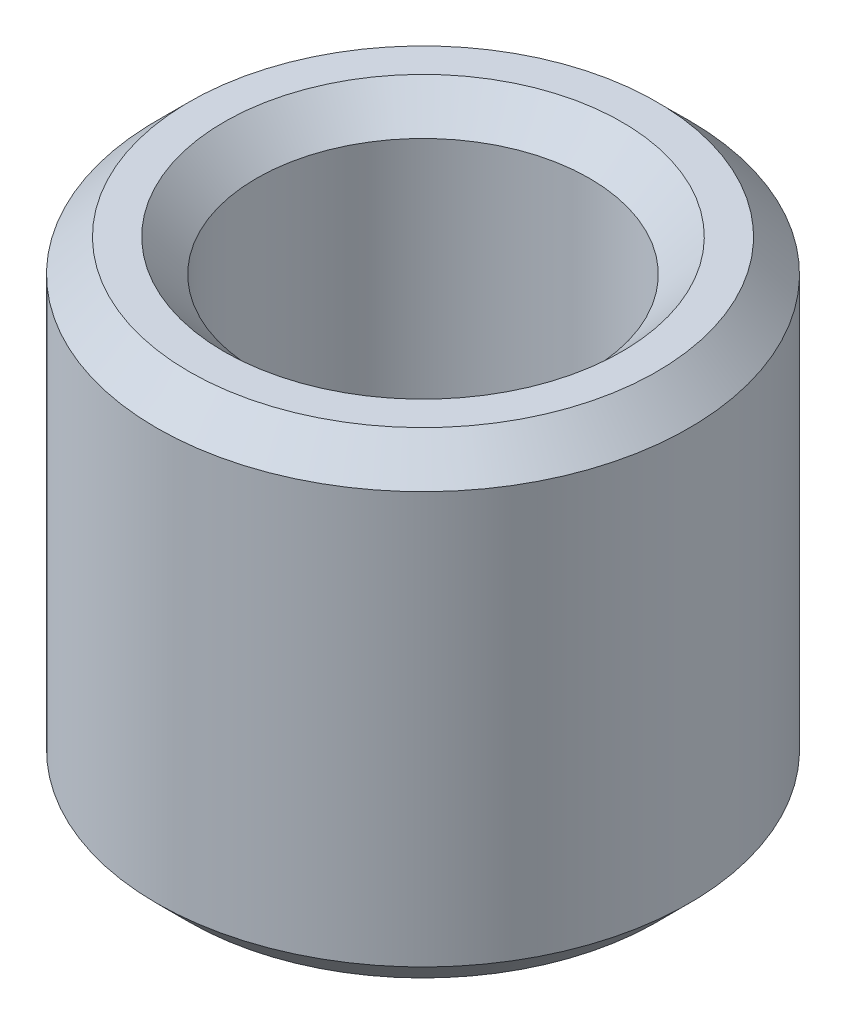
from build123d import *

# Parameters (mm, degrees)
SKETCH1_R           = 22.5
BOSS_EXTRUDE1_DEPTH = 40.2782778
SKETCH2_R           = 14.06292986
CUT_EXTRUDE1_DEPTH  = 52.330689286
CHAMFER1_SIZE       = 2.746556927


with BuildPart() as part:
    # Sketch1 → Boss-Extrude1 (new body)
    with BuildSketch(Plane(origin=(0, 0, 0), x_dir=(1, 0, 0), z_dir=(0, 1, 0))):
        Circle(SKETCH1_R)
    extrude(amount=BOSS_EXTRUDE1_DEPTH)

    # Sketch2 → Cut-Extrude1 (cut, through all)
    with BuildSketch(Plane(origin=(0, 0, 0), x_dir=(1, 0, 0), z_dir=(0, 1, 0))):
        Circle(SKETCH2_R)
    extrude(amount=CUT_EXTRUDE1_DEPTH, mode=Mode.SUBTRACT)

    # Chamfer1
    chamfer1_edges = [part.edges().sort_by_distance(p)[0] for p in [
        (-14.06292986, 40.2782778, 0),
        (-14.06292986, 0, 0),
        (-22.5, 0, 0),
        (-22.5, 40.2782778, 0),
    ]]
    chamfer(chamfer1_edges, length=CHAMFER1_SIZE)


solid = part.part
